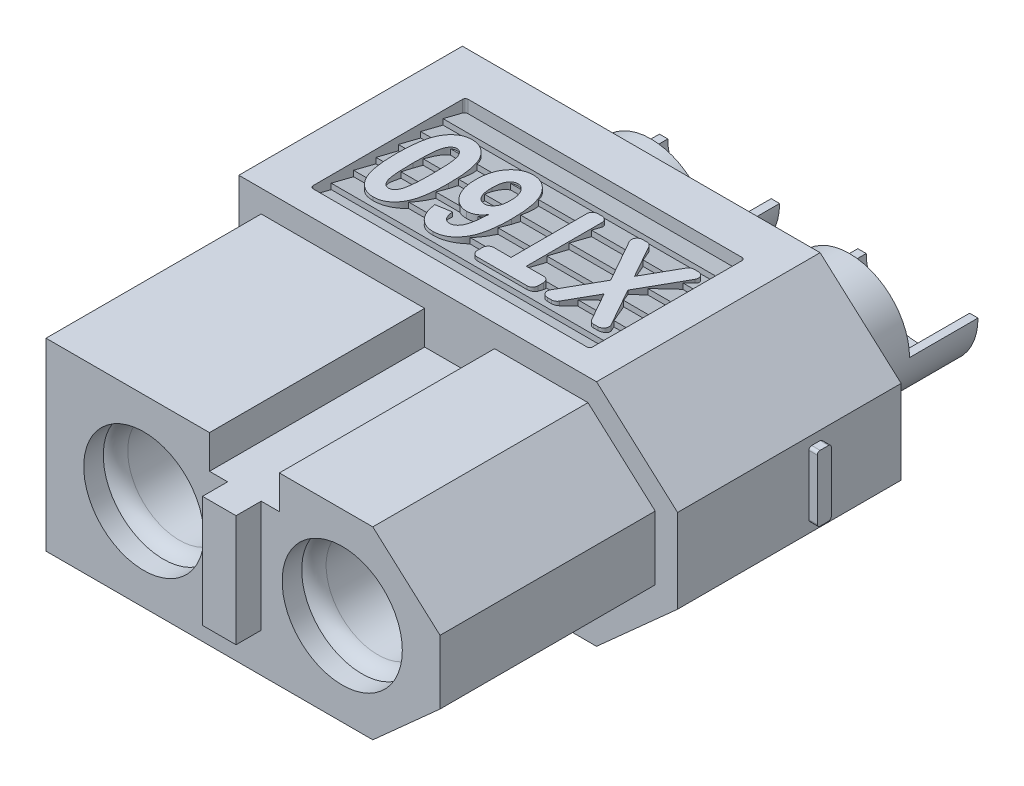
from build123d import *
from OCP.BRepFilletAPI import BRepFilletAPI_MakeChamfer

# Parameters (mm, degrees)
RESSALTO_EXTRUS_O1_DEPTH = 16.2
CORTE_EXTRUS_O1_DEPTH    = 9.4
ESBO_O3_W                = 1.6
ESBO_O3_H                = 0.91
RESSALTO_EXTRUS_O2_DEPTH = 8
ESBO_O4_W                = 1.6
ESBO_O4_H                = 4.7
CORTE_EXTRUS_O2_DEPTH    = 1.5
ESBO_O5_R                = 3
CORTE_EXTRUS_O3_DEPTH    = 2
ESBO_O6_R                = 2.15
CORTE_EXTRUS_O4_DEPTH    = 23.701762046
RESSALTO_EXTRUS_O3_DEPTH = 0.3
RESSALTO_EXTRUS_O4_DEPTH = 0.3
CORTE_EXTRUS_O5_DEPTH    = 0.75
RESSALTO_EXTRUS_O7_REACH = 25.143
RESSALTO_EXTRUS_O8_DEPTH = 0.3
RESSALTO_EXTRUS_O9_DEPTH = 0.3
CUT_EXTRUDE1_DEPTH       = 10
BOSS_EXTRUDE1_DEPTH      = 1.2
BOSS_EXTRUDE2_START      = 2
SKETCH4_R                = 3
BOSS_EXTRUDE2_DEPTH      = 2
BOSS_EXTRUDE3_DEPTH      = 7.7
SKETCH6_R                = 2.15
CUT_EXTRUDE2_DEPTH       = 0.7
SKETCH7_R                = 1.85
CUT_EXTRUDE3_DEPTH       = 10.65
SKETCH8_R                = 2.15
SKETCH8_R_2              = 1.85
BOSS_EXTRUDE4_DEPTH      = 19.9
CHAMFER1_SIZE            = 1
CHAMFER1_SIZE2           = 1.732050808
SKETCH9_W                = 1.2
SKETCH9_H                = 4
BOSS_EXTRUDE5_DEPTH      = 0.9
SKETCH10_W               = 2.5
SKETCH10_H               = 1.2
CUT_EXTRUDE4_DEPTH       = 7.7
FILLET2_R                = 0.7
SKETCH11_W               = 2.45
SKETCH11_H               = 6.904904847
CUT_EXTRUDE5_DEPTH       = 16.9
CUT_EXTRUDE7_START       = -1
SKETCH12_R               = 3
SKETCH12_R_2             = 2.15
CUT_EXTRUDE7_DEPTH       = 1
CHAMFER3_SIZE2           = 1.7
CHAMFER3_SIZE            = 0.618749398


with BuildPart() as part:
    # Esboço1 → Ressalto-extrusão1 (new body)
    with BuildSketch(Plane.XY):
        Polygon((0, 0), (12.8, 0), (15.7, 2.6), (15.7, 5.6), (12.8, 8.2), (0, 8.2), align=None)
    extrude(amount=RESSALTO_EXTRUS_O1_DEPTH)

    # Esboço2 → Corte-extrusão1 (cut)
    with BuildSketch(Plane.XY.offset(16.2)):
        Polygon((0.75, 7.45), (0.75, 0.75), (12.513018725, 0.75), (14.95, 2.934879763), (14.95, 5.265120237), (12.513018725, 7.45), align=None)
    extrude(amount=-CORTE_EXTRUS_O1_DEPTH, mode=Mode.SUBTRACT)

    # Esboço3 → Ressalto-extrusão2 (add)
    with BuildSketch(Plane.XY.offset(6.8)):
        with Locations((7.9, 1.205)):
            Rectangle(ESBO_O3_W, ESBO_O3_H)
    extrude(amount=RESSALTO_EXTRUS_O2_DEPTH)

    # Esboço4 → Corte-extrusão2 (cut)
    with BuildSketch(Plane.XY.offset(6.8)):
        with Locations((7.9, 4.1)):
            Rectangle(ESBO_O4_W, ESBO_O4_H)
    extrude(amount=-CORTE_EXTRUS_O2_DEPTH, mode=Mode.SUBTRACT)

    # Esboço5 → Corte-extrusão3 (cut)
    with BuildSketch(Plane(origin=(0, 0, 0), x_dir=(-1, 0, 0), z_dir=(0, 0, -1))):
        with Locations((-11.35, 4.1)):
            Circle(ESBO_O5_R)
        with Locations((-4.25, 4.1)):
            Circle(ESBO_O5_R)
    extrude(amount=-CORTE_EXTRUS_O3_DEPTH, mode=Mode.SUBTRACT)

    # Esboço6 → Corte-extrusão4 (cut, through all)
    with BuildSketch(Plane(origin=(0, 0, 2), x_dir=(-1, 0, 0), z_dir=(0, 0, -1))):
        with Locations((-11.35, 4.1)):
            Circle(ESBO_O6_R)
        with Locations((-4.25, 4.1)):
            Circle(ESBO_O6_R)
    extrude(amount=-CORTE_EXTRUS_O4_DEPTH, mode=Mode.SUBTRACT)

    # Esboço7 → Ressalto-extrusão3 (add)
    with BuildSketch(Plane.ZY):
        with BuildLine():
            Line((2.8, 4.35), (2.05, 4.35))
            ThreePointArc((2.05, 4.35), (1.979289322, 4.320710678), (1.95, 4.25))
            Line((1.95, 4.25), (1.95, 3.95))
            ThreePointArc((1.95, 3.95), (1.979289322, 3.879289322), (2.05, 3.85))
            Line((2.05, 3.85), (2.8, 3.85))
            ThreePointArc((2.8, 3.85), (2.870710678, 3.820710678), (2.9, 3.75))
            Line((2.9, 3.75), (2.9, 3))
            ThreePointArc((2.9, 3), (2.929289322, 2.929289322), (3, 2.9))
            Line((3, 2.9), (3.3, 2.9))
            ThreePointArc((3.3, 2.9), (3.370710678, 2.929289322), (3.4, 3))
            Line((3.4, 3), (3.4, 3.75))
            ThreePointArc((3.4, 3.75), (3.429289322, 3.820710678), (3.5, 3.85))
            Line((3.5, 3.85), (4.25, 3.85))
            ThreePointArc((4.25, 3.85), (4.320710678, 3.879289322), (4.35, 3.95))
            Line((4.35, 3.95), (4.35, 4.25))
            ThreePointArc((4.35, 4.25), (4.320710678, 4.320710678), (4.25, 4.35))
            Line((4.25, 4.35), (3.5, 4.35))
            ThreePointArc((3.5, 4.35), (3.429289322, 4.379289322), (3.4, 4.45))
            Line((3.4, 4.45), (3.4, 5.2))
            ThreePointArc((3.4, 5.2), (3.370710678, 5.270710678), (3.3, 5.3))
            Line((3.3, 5.3), (3, 5.3))
            ThreePointArc((3, 5.3), (2.929289322, 5.270710678), (2.9, 5.2))
            Line((2.9, 5.2), (2.9, 4.45))
            ThreePointArc((2.9, 4.45), (2.870710678, 4.379289322), (2.8, 4.35))
        make_face()
    extrude(amount=RESSALTO_EXTRUS_O3_DEPTH)

    # Esboço8 → Ressalto-extrusão4 (add)
    with BuildSketch(Plane(origin=(15.7, 0, 0), x_dir=(0, 0, -1), z_dir=(1, 0, 0))):
        with BuildLine():
            Line((-3.2, 2.925), (-2.9, 2.925))
            ThreePointArc((-2.9, 2.925), (-2.829289322, 2.954289322), (-2.8, 3.025))
            Line((-2.8, 3.025), (-2.8, 5.175))
            ThreePointArc((-2.8, 5.175), (-2.829289322, 5.245710678), (-2.9, 5.275))
            Line((-2.9, 5.275), (-3.2, 5.275))
            ThreePointArc((-3.2, 5.275), (-3.270710678, 5.245710678), (-3.3, 5.175))
            Line((-3.3, 5.175), (-3.3, 3.025))
            ThreePointArc((-3.3, 3.025), (-3.270710678, 2.954289322), (-3.2, 2.925))
        make_face()
    extrude(amount=RESSALTO_EXTRUS_O4_DEPTH)

    # Esboço9 → Corte-extrusão5 (cut)
    with BuildSketch(Plane.XZ):
        with BuildLine():
            Line((1.75, 7.093123445), (11.55, 7.093123445))
            ThreePointArc((11.55, 7.093123445), (11.620710678, 7.063834123), (11.65, 6.993123445))
            Line((11.65, 6.993123445), (11.65, 1.643123445))
            ThreePointArc((11.65, 1.643123445), (11.620710678, 1.572412766), (11.55, 1.543123445))
            Line((11.55, 1.543123445), (1.75, 1.543123445))
            ThreePointArc((1.75, 1.543123445), (1.679289322, 1.572412766), (1.65, 1.643123445))
            Line((1.65, 1.643123445), (1.65, 6.993123445))
            ThreePointArc((1.65, 6.993123445), (1.679289322, 7.063834123), (1.75, 7.093123445))
        make_face()
    corte_extrus_o5 = extrude(amount=-CORTE_EXTRUS_O5_DEPTH, mode=Mode.SUBTRACT)

    # Ressalto-extrusão7: up to this face of the body (flat: up to its plane)
    ressalto_extrus_o7_end = Plane(part.part.faces().sort_by_distance((11.65, 0.375, 4.318123445))[0])
    # Esboço10 → Ressalto-extrusão7 (add, up to the picked face)
    with BuildSketch(Plane(origin=(1.65, 0, 0), x_dir=(0, 0, -1), z_dir=(1, 0, 0)), mode=Mode.PRIVATE) as ressalto_extrus_o7_sk1:
        Polygon((-3.143123445, 0.45), (-3.143123445, 0.25), (-2.343123445, 0.45), (-2.343123445, 0.25), (-1.543123445, 0.45), (-1.543123445, 0.75), (-7.143123445, 0.75), (-7.143123445, 0.45), (-7.143123445, 0.25), (-6.343123445, 0.45), (-6.343123445, 0.25), (-5.543123445, 0.45), (-5.543123445, 0.25), (-4.743123445, 0.45), (-4.743123445, 0.25), (-3.943123445, 0.45), (-3.943123445, 0.25), align=None)
    ressalto_extrus_o7_tool1 = split(extrude(ressalto_extrus_o7_sk1.sketch, amount=RESSALTO_EXTRUS_O7_REACH, mode=Mode.PRIVATE), bisect_by=ressalto_extrus_o7_end, keep=Keep.BOTH, mode=Mode.PRIVATE)
    ressalto_extrus_o7 = ressalto_extrus_o7_tool1.solids().sort_by(Axis((1.65, 0.545833, 4.376457), (1, 0, 0)))[0]
    add(ressalto_extrus_o7)

    # Espelhar1: Corte-extrusão5, Ressalto-extrusão7 across plane
    add(corte_extrus_o5.mirror(Plane.ZX.offset(4.1)), mode=Mode.SUBTRACT)
    add(ressalto_extrus_o7.mirror(Plane.ZX.offset(4.1)))

    # Esboço11 → Ressalto-extrusão8 (add)
    with BuildSketch(Plane(origin=(0, 0.5, 0), x_dir=(-1, 0, 0), z_dir=(0, -1, 0))):
        with BuildLine():
            add(Edge.make_bspline(
                [(-5.023961169, -6.00435038), (-5.023731287, -5.995665006), (-5.023167139, -5.974350412), (-5.020606597, -5.937326865), (-5.015634685, -5.891913541), (-5.008374694, -5.840781928), (-4.996852924, -5.786628833), (-4.98507998, -5.730621834), (-4.970342979, -5.676032154), (-4.952923205, -5.625615372), (-4.932961076, -5.58080345), (-4.908069139, -5.546064886), (-4.881021, -5.518802059), (-4.858555504, -5.515226002), (-4.848332577, -5.513598717)],
                knots=[0, 0, 0, 0, 0.571173607, 1.401705031, 2.438868434, 3.574367159, 4.795071872, 6.077422199, 7.33722776, 8.507872236, 9.587019565, 10.5375099, 11.334493681, 12, 12, 12, 12], degree=3))
            Line((-4.848332577, -5.513598717), (-4.020609309, -5.513598717))
            Line((-4.020609309, -5.513598717), (-3.49036222, -2.555643484))
            add(Edge.make_bspline(
                [(-3.49036222, -2.555643484), (-3.487094486, -2.546511208), (-3.480493928, -2.528064751), (-3.462940698, -2.502333792), (-3.435671591, -2.480838398), (-3.397551986, -2.465314687), (-3.349369795, -2.453459182), (-3.289027368, -2.44320829), (-3.214317598, -2.436547775), (-3.159289179, -2.436398815), (-3.129021098, -2.436316881)],
                knots=[0, 0, 0, 0, 0.572152175, 1.155701031, 1.815395622, 2.59412663, 3.570478222, 4.74694284, 6.210673715, 8, 8, 8, 8], degree=3))
            add(Edge.make_bspline(
                [(-3.129021098, -2.436316881), (-3.099590319, -2.436400624), (-3.045954651, -2.43655324), (-2.973504555, -2.44319605), (-2.916339343, -2.453001646), (-2.873392308, -2.464895138), (-2.841745516, -2.480373872), (-2.823600732, -2.503205048), (-2.815413627, -2.529106558), (-2.817188659, -2.546643114), (-2.818099667, -2.555643484)],
                knots=[0, 0, 0, 0, 1.887972692, 3.440706659, 4.664361098, 5.602810567, 6.303007865, 6.878566498, 7.424441367, 8, 8, 8, 8], degree=3))
            Line((-2.818099667, -2.555643484), (-3.348346756, -5.513598717))
            Line((-3.348346756, -5.513598717), (-2.527346113, -5.513598717))
            add(Edge.make_bspline(
                [(-2.527346113, -5.513598717), (-2.5158995, -5.51461475), (-2.493831667, -5.516573553), (-2.472715893, -5.546733002), (-2.463160736, -5.584517711), (-2.462285798, -5.613492933), (-2.461800514, -5.629564007)],
                knots=[0, 0, 0, 0, 0.876044977, 1.688920123, 2.718162199, 4, 4, 4, 4], degree=3))
            add(Edge.make_bspline(
                [(-2.461800514, -5.629564007), (-2.461977539, -5.638813278), (-2.462407487, -5.661277307), (-2.466216965, -5.699071845), (-2.470998184, -5.745356077), (-2.478414587, -5.796958197), (-2.488582941, -5.852446205), (-2.500798033, -5.908853075), (-2.514928426, -5.964134452), (-2.534662336, -6.013696946), (-2.55458049, -6.057861337), (-2.578178377, -6.092213603), (-2.605428151, -6.117627625), (-2.627240684, -6.121178211), (-2.637429106, -6.122836655)],
                knots=[0, 0, 0, 0, 0.605043227, 1.469489812, 2.48341245, 3.649686645, 4.879047589, 6.17309233, 7.426799419, 8.604393452, 9.661770922, 10.582105409, 11.337715268, 12, 12, 12, 12], degree=3))
            Line((-2.637429106, -6.122836655), (-4.960096227, -6.122836655))
            add(Edge.make_bspline(
                [(-4.960096227, -6.122836655), (-4.969934281, -6.121426251), (-4.99037917, -6.118495228), (-5.011571026, -6.089692698), (-5.021864767, -6.050856537), (-5.023211361, -6.020983972), (-5.023961169, -6.00435038)],
                knots=[0, 0, 0, 0, 0.771159906, 1.602580858, 2.665073155, 4, 4, 4, 4], degree=3))
        make_face()
        with BuildLine():
            add(Edge.make_bspline(
                [(-8.005445591, -5.732084047), (-8.005233805, -5.721157588), (-8.004755518, -5.69648183), (-8.002257862, -5.656087157), (-7.997216524, -5.609824927), (-7.989672588, -5.559640101), (-7.979672262, -5.507819052), (-7.968127736, -5.455855322), (-7.954624636, -5.406442246), (-7.937593996, -5.361995207), (-7.919841845, -5.322908562), (-7.899498565, -5.292757131), (-7.878287508, -5.269109619), (-7.86042282, -5.265583769), (-7.852505861, -5.264021244)],
                knots=[0, 0, 0, 0, 0.766224037, 1.73040148, 2.836554055, 4.028156414, 5.287742343, 6.536100283, 7.760906599, 8.873491865, 9.874955351, 10.751978432, 11.446923712, 12, 12, 12, 12], degree=3))
            add(Edge.make_bspline(
                [(-7.852505861, -5.264021244), (-7.845452061, -5.264904506), (-7.829851748, -5.266857944), (-7.804797296, -5.276024895), (-7.776406148, -5.29162043), (-7.730609729, -5.322094595), (-7.661287561, -5.366554766), (-7.562598175, -5.424293206), (-7.440427841, -5.481447336), (-7.322385437, -5.522805842), (-7.215484092, -5.550613186), (-7.125251104, -5.565599411), (-7.027726856, -5.57352652), (-6.960370911, -5.575015091), (-6.925623866, -5.575783003)],
                knots=[0, 0, 0, 0, 0.256781181, 0.567901939, 0.958081965, 1.427920935, 2.558951999, 3.940235169, 5.564546954, 7.434602361, 8.460374185, 9.560843022, 10.741707222, 12, 12, 12, 12], degree=3))
            add(Edge.make_bspline(
                [(-6.925623866, -5.575783003), (-6.890276179, -5.575112001), (-6.820714939, -5.573791525), (-6.71881609, -5.559310648), (-6.620879787, -5.539244265), (-6.528038512, -5.508289798), (-6.439439434, -5.470183053), (-6.354808917, -5.425881372), (-6.274209796, -5.374938124), (-6.197898312, -5.317782161), (-6.125337935, -5.254656842), (-6.057780279, -5.185519577), (-5.993086757, -5.112490516), (-5.915245473, -5.00655333), (-5.827853488, -4.865004138), (-5.741758712, -4.683337999), (-5.673142777, -4.492613249), (-5.626520902, -4.295160578), (-5.595410147, -4.096109002), (-5.592019032, -3.96274579), (-5.59034237, -3.896807277)],
                knots=[0, 0, 0, 0, 0.80118641, 1.5766667, 2.33060899, 3.065984097, 3.79180022, 4.516503127, 5.230402579, 5.952175127, 6.677184339, 7.409506429, 8.143480375, 8.888129179, 10.388673858, 11.909102309, 13.440443778, 14.976838324, 16.505264068, 18, 18, 18, 18], degree=3))
            add(Edge.make_bspline(
                [(-5.59034237, -3.896807277), (-5.590871805, -3.861481942), (-5.591899808, -3.792890748), (-5.603110001, -3.693712719), (-5.620667577, -3.601229886), (-5.644851035, -3.51534807), (-5.675878531, -3.435840868), (-5.713888363, -3.363292733), (-5.757702979, -3.297278928), (-5.807513278, -3.237950776), (-5.863357452, -3.185891772), (-5.924157557, -3.139448548), (-5.992135639, -3.102310572), (-6.064487022, -3.070033176), (-6.14190109, -3.044779053), (-6.224178948, -3.027460146), (-6.310743564, -3.016057319), (-6.370129331, -3.015001296), (-6.400418746, -3.014462676)],
                knots=[0, 0, 0, 0, 1.245481004, 2.418350133, 3.515051619, 4.562728981, 5.560783658, 6.519734471, 7.445909044, 8.350382342, 9.245035617, 10.134216955, 11.041061373, 11.969972066, 12.926017502, 13.906558924, 14.932250809, 16, 16, 16, 16], degree=3))
            add(Edge.make_bspline(
                [(-6.400418746, -3.014462676), (-6.441984642, -3.015611215), (-6.525415258, -3.017916548), (-6.647858981, -3.041043496), (-6.766205581, -3.074435661), (-6.838672757, -3.110262009), (-6.874363846, -3.127906982)],
                knots=[0, 0, 0, 0, 1.012553476, 2.032386399, 3.030923011, 4, 4, 4, 4], degree=3))
            Line((-6.874363846, -3.127906982), (-7.027303577, -3.975798127))
            Line((-7.027303577, -3.975798127), (-6.405460715, -3.975798127))
            add(Edge.make_bspline(
                [(-6.405460715, -3.975798127), (-6.396032338, -3.977054064), (-6.376498001, -3.979656199), (-6.354225524, -4.004786531), (-6.340822506, -4.042285405), (-6.340248828, -4.071973018), (-6.339915116, -4.089242433)],
                knots=[0, 0, 0, 0, 0.76021162, 1.575056727, 2.589399796, 4, 4, 4, 4], degree=3))
            add(Edge.make_bspline(
                [(-6.339915116, -4.089242433), (-6.340007123, -4.100178481), (-6.34021529, -4.124921501), (-6.345257389, -4.164911883), (-6.350408738, -4.210435976), (-6.359386856, -4.258457362), (-6.368207285, -4.308513896), (-6.379561212, -4.358263352), (-6.393351556, -4.406000103), (-6.410607636, -4.448661231), (-6.431034, -4.484869643), (-6.451535593, -4.514643738), (-6.476695242, -4.535852891), (-6.496191515, -4.539001749), (-6.50545977, -4.540498671)],
                knots=[0, 0, 0, 0, 0.777619142, 1.759378421, 2.864503789, 4.037640318, 5.233916541, 6.481404614, 7.667005543, 8.766363746, 9.747920663, 10.616982492, 11.342532841, 12, 12, 12, 12], degree=3))
            Line((-6.50545977, -4.540498671), (-7.618054295, -4.540498671))
            add(Edge.make_bspline(
                [(-7.618054295, -4.540498671), (-7.631028748, -4.539695256), (-7.655886414, -4.538155997), (-7.690371762, -4.526433837), (-7.718598065, -4.50614808), (-7.74018276, -4.478209964), (-7.754374786, -4.44306982), (-7.760248857, -4.401532584), (-7.761457637, -4.353981025), (-7.756174688, -4.320568781), (-7.753347134, -4.302685793)],
                knots=[0, 0, 0, 0, 0.968467303, 1.855479917, 2.680305945, 3.530243379, 4.459230605, 5.47774572, 6.650032557, 8, 8, 8, 8], degree=3))
            Line((-7.753347134, -4.302685793), (-7.488643754, -2.832951787))
            add(Edge.make_bspline(
                [(-7.488643754, -2.832951787), (-7.484932567, -2.816378345), (-7.478008418, -2.785456437), (-7.46492174, -2.741793185), (-7.446178544, -2.7041663), (-7.430134023, -2.682328748), (-7.422257827, -2.671608774)],
                knots=[0, 0, 0, 0, 1.156316651, 2.157398464, 3.095473648, 4, 4, 4, 4], degree=3))
            add(Edge.make_bspline(
                [(-7.422257827, -2.671608774), (-7.416231591, -2.665574456), (-7.402120311, -2.651444251), (-7.37426183, -2.631630505), (-7.336320112, -2.612116828), (-7.271721396, -2.580005779), (-7.173655195, -2.540224112), (-7.038673137, -2.495401693), (-6.884344834, -2.453408859), (-6.714006485, -2.419933315), (-6.533346086, -2.394808927), (-6.409750166, -2.392235662), (-6.34747807, -2.390939158)],
                knots=[0, 0, 0, 0, 0.226925493, 0.53137799, 0.905335483, 1.362486358, 2.452980185, 3.720011825, 5.149871189, 6.709721602, 8.342238718, 10, 10, 10, 10], degree=3))
            add(Edge.make_bspline(
                [(-6.34747807, -2.390939158), (-6.290017279, -2.392085578), (-6.17847988, -2.394310898), (-6.016534188, -2.41097196), (-5.865393213, -2.439681829), (-5.724343707, -2.47847325), (-5.594644173, -2.53031849), (-5.474482576, -2.59117225), (-5.366924212, -2.665978248), (-5.269134234, -2.750285511), (-5.183278961, -2.846044213), (-5.107514929, -2.951618377), (-5.045184949, -3.068619941), (-4.991498741, -3.194272892), (-4.950571377, -3.330444745), (-4.92155039, -3.476194463), (-4.903510692, -3.631932588), (-4.901479969, -3.739054811), (-4.900432925, -3.794287238)],
                knots=[0, 0, 0, 0, 1.198820216, 2.327035275, 3.391905235, 4.405853918, 5.373943326, 6.301912563, 7.209749437, 8.100436241, 8.990125377, 9.886946289, 10.804904538, 11.750377292, 12.733955993, 13.765538726, 14.847907423, 16, 16, 16, 16], degree=3))
            add(Edge.make_bspline(
                [(-4.900432925, -3.794287238), (-4.900905574, -3.845294829), (-4.901844387, -3.946610285), (-4.914742729, -4.097966778), (-4.932583422, -4.247805266), (-4.958701667, -4.395928796), (-4.99253789, -4.541087834), (-5.032356058, -4.683657708), (-5.081529457, -4.821948844), (-5.13678848, -4.956828646), (-5.199584663, -5.086811605), (-5.270198263, -5.211779027), (-5.345934724, -5.33288119), (-5.430056432, -5.447884454), (-5.521068083, -5.55643969), (-5.618182845, -5.658754515), (-5.724187844, -5.75176642), (-5.835355528, -5.838862544), (-5.954599059, -5.916135709), (-6.079758992, -5.985133465), (-6.211692275, -6.045266744), (-6.350247896, -6.095365279), (-6.495259856, -6.136376965), (-6.647191877, -6.164275874), (-6.805564122, -6.182714335), (-6.913525434, -6.184799742), (-6.968480603, -6.18586127)],
                knots=[0, 0, 0, 0, 1.038419447, 2.062593738, 3.091332759, 4.110730389, 5.12359561, 6.125738619, 7.123390902, 8.110666656, 9.092886964, 10.060808202, 11.032487199, 12.000004954, 12.959688702, 13.915839818, 14.869418181, 15.828983254, 16.789344864, 17.759482257, 18.737170252, 19.738663678, 20.757278993, 21.802195652, 22.881259323, 24, 24, 24, 24], degree=3))
            add(Edge.make_bspline(
                [(-6.968480603, -6.18586127), (-7.0290792, -6.184331494), (-7.147145904, -6.18135097), (-7.317412746, -6.155941012), (-7.473193069, -6.119872726), (-7.612804056, -6.077894875), (-7.732975101, -6.029341039), (-7.819588267, -5.98510127), (-7.876269531, -5.949103523), (-7.909395725, -5.926063462), (-7.935436602, -5.907072311), (-7.960438269, -5.88640523), (-7.981066611, -5.858738461), (-7.997461203, -5.821981054), (-8.004140504, -5.77910018), (-8.004986589, -5.74861974), (-8.005445591, -5.732084047)],
                knots=[0, 0, 0, 0, 2.087911378, 4.067962421, 5.920740836, 7.59756473, 9.087613358, 10.383270069, 10.94314657, 11.401166784, 11.773890065, 12.054576704, 12.51614555, 12.948510593, 13.429565086, 14, 14, 14, 14], degree=3))
        make_face()
        with BuildLine():
            Line((-9.699547225, -3.845547257), (-9.470137629, -2.552282171))
            add(Edge.make_bspline(
                [(-9.470137629, -2.552282171), (-9.466859766, -2.543161727), (-9.460238748, -2.52473917), (-9.442946515, -2.498964908), (-9.414937846, -2.478219246), (-9.376716334, -2.463027083), (-9.328197381, -2.450399387), (-9.267224842, -2.442997509), (-9.192960802, -2.436667812), (-9.138508583, -2.436440768), (-9.108796506, -2.436316881)],
                knots=[0, 0, 0, 0, 0.573468519, 1.15835994, 1.80927796, 2.60501552, 3.583613393, 4.774068884, 6.239757445, 8, 8, 8, 8], degree=3))
            add(Edge.make_bspline(
                [(-9.108796506, -2.436316881), (-9.07908089, -2.4364132), (-9.025460301, -2.436587003), (-8.953170251, -2.442958428), (-8.895984093, -2.450121251), (-8.853113738, -2.462392488), (-8.821882373, -2.47787117), (-8.803149573, -2.499931887), (-8.795230917, -2.525777934), (-8.796978272, -2.543292888), (-8.797875076, -2.552282171)],
                knots=[0, 0, 0, 0, 1.911024314, 3.448363529, 4.669437815, 5.610387303, 6.312449918, 6.875579012, 7.422908085, 8, 8, 8, 8], degree=3))
            Line((-8.797875076, -2.552282171), (-9.027284672, -3.845547257))
            Line((-9.027284672, -3.845547257), (-8.486953645, -5.845528352))
            add(Edge.make_bspline(
                [(-8.486953645, -5.845528352), (-8.478833829, -5.87511468), (-8.464477661, -5.927424524), (-8.452459229, -5.997552522), (-8.451114009, -6.053647581), (-8.470343992, -6.090049885), (-8.495365993, -6.108483462), (-8.519933136, -6.118787125), (-8.549846675, -6.127196016), (-8.58564508, -6.132928512), (-8.62837865, -6.135711651), (-8.678523457, -6.13827363), (-8.736802258, -6.139884763), (-8.778266582, -6.140275181), (-8.80039606, -6.140483547)],
                knots=[0, 0, 0, 0, 1.871476962, 3.308848235, 4.353767051, 5.234513845, 5.686208054, 6.229944972, 6.852727002, 7.581222775, 8.43941278, 9.467243455, 10.648269802, 12, 12, 12, 12], degree=3))
            add(Edge.make_bspline(
                [(-8.80039606, -6.140483547), (-8.832318453, -6.140341829), (-8.888907188, -6.140090606), (-8.964273956, -6.138021895), (-9.021780456, -6.129917263), (-9.066180039, -6.120808034), (-9.098903106, -6.102781231), (-9.120223894, -6.076561798), (-9.13175067, -6.04348518), (-9.138106211, -6.019785287), (-9.141569306, -6.006871365)],
                knots=[0, 0, 0, 0, 1.872853804, 3.32000257, 4.414278968, 5.278892846, 5.96356431, 6.558835249, 7.214718403, 8, 8, 8, 8], degree=3))
            Line((-9.141569306, -6.006871365), (-9.363415948, -5.124526764))
            add(Edge.make_bspline(
                [(-9.363415948, -5.124526764), (-9.375252204, -5.073003414), (-9.398319243, -4.972592338), (-9.4313429, -4.82328113), (-9.459458724, -4.674488444), (-9.474906837, -4.574439649), (-9.482742551, -4.523692108)],
                knots=[0, 0, 0, 0, 1.035280845, 2.017602979, 2.994472888, 4, 4, 4, 4], degree=3))
            Line((-9.482742551, -4.523692108), (-9.487784521, -4.523692108))
            add(Edge.make_bspline(
                [(-9.487784521, -4.523692108), (-9.511639997, -4.574225455), (-9.559347354, -4.675284529), (-9.635013885, -4.824621142), (-9.714451456, -4.972922929), (-9.770445333, -5.070325057), (-9.798705951, -5.119484795)],
                knots=[0, 0, 0, 0, 0.997419509, 1.994688626, 2.987901158, 4, 4, 4, 4], degree=3))
            Line((-9.798705951, -5.119484795), (-10.326432055, -6.015274647))
            add(Edge.make_bspline(
                [(-10.326432055, -6.015274647), (-10.333247008, -6.02658162), (-10.346131701, -6.047959155), (-10.367813932, -6.077469508), (-10.397293269, -6.100071343), (-10.435252647, -6.11659373), (-10.484479232, -6.127846444), (-10.547170712, -6.136190535), (-10.628360793, -6.139453445), (-10.688895234, -6.140111868), (-10.723066962, -6.140483547)],
                knots=[0, 0, 0, 0, 0.717854675, 1.357212346, 1.975202924, 2.710745717, 3.589209825, 4.710534674, 6.143094915, 8, 8, 8, 8], degree=3))
            add(Edge.make_bspline(
                [(-10.723066962, -6.140483547), (-10.746315279, -6.140244969), (-10.789737126, -6.139799365), (-10.850571208, -6.138566379), (-10.902659649, -6.134868561), (-10.946544735, -6.131420338), (-10.982700322, -6.124853597), (-11.011731032, -6.115530144), (-11.035346625, -6.104645101), (-11.05126765, -6.088522037), (-11.061638069, -6.069687635), (-11.063660752, -6.047269133), (-11.058519319, -6.022504265), (-11.043126489, -5.98211466), (-11.009623355, -5.922933123), (-10.97952139, -5.87342411), (-10.962560496, -5.845528352)],
                knots=[0, 0, 0, 0, 1.604706746, 2.9971774, 4.198278929, 5.208200935, 6.034760513, 6.725606941, 7.313579332, 7.805702227, 8.264006837, 8.76998451, 9.319854892, 9.998695175, 11.74547258, 14, 14, 14, 14], degree=3))
            Line((-10.962560496, -5.845528352), (-9.699547225, -3.845547257))
        make_face()
    extrude(amount=RESSALTO_EXTRUS_O8_DEPTH)

    # Esboço12 → Ressalto-extrusão9 (add)
    # profile 1 of 4: a face of its own
    with BuildSketch(Plane(origin=(0, 7.7, 0), x_dir=(1, 0, 0), z_dir=(0, 1, 0))):
        with BuildLine():
            Line((11.185044584, -2.866454717), (10.320104725, -4.398379126))
            Line((10.320104725, -4.398379126), (11.094198639, -5.769814539))
            ThreePointArc((11.094198639, -5.769814539), (11.092744365, -5.968965447), (10.920028151, -6.068123445))
            Line((10.920028151, -6.068123445), (10.7649422, -6.068123445))
            ThreePointArc((10.7649422, -6.068123445), (10.664138477, -6.040862003), (10.590815302, -5.966509539))
            Line((10.590815302, -5.966509539), (10.012576316, -4.943123445))
            Line((10.012576316, -4.943123445), (9.435030455, -5.966426179))
            ThreePointArc((9.435030455, -5.966426179), (9.361701545, -6.040837872), (9.260856483, -6.068123445))
            Line((9.260856483, -6.068123445), (9.105124481, -6.068123445))
            ThreePointArc((9.105124481, -6.068123445), (8.932408267, -5.968965447), (8.930953993, -5.769814539))
            Line((8.930953993, -5.769814539), (9.705047907, -4.398379126))
            Line((9.705047907, -4.398379126), (8.840108048, -2.866454717))
            ThreePointArc((8.840108048, -2.866454717), (8.841543221, -2.667292533), (9.01426591, -2.568123445))
            Line((9.01426591, -2.568123445), (9.169940798, -2.568123445))
            ThreePointArc((9.169940798, -2.568123445), (9.270790107, -2.595411497), (9.344119604, -2.669829276))
            Line((9.344119604, -2.669829276), (10.012576316, -3.854345035))
            Line((10.012576316, -3.854345035), (10.681728288, -2.669756355))
            ThreePointArc((10.681728288, -2.669756355), (10.755052773, -2.595390388), (10.855865922, -2.568123445))
            Line((10.855865922, -2.568123445), (11.010886722, -2.568123445))
            ThreePointArc((11.010886722, -2.568123445), (11.183609411, -2.667292533), (11.185044584, -2.866454717))
        make_face()
    # profile 2 of 4: a face of its own
    with BuildSketch(Plane(origin=(0, 7.7, 0), x_dir=(1, 0, 0), z_dir=(0, 1, 0))):
        with BuildLine():
            Line((7.762576316, -2.768123445), (7.762576316, -5.477214354))
            Line((7.762576316, -5.477214354), (8.380758134, -5.477214354))
            ThreePointArc((8.380758134, -5.477214354), (8.522179491, -5.535792997), (8.580758134, -5.677214354))
            Line((8.580758134, -5.677214354), (8.580758134, -5.868123445))
            ThreePointArc((8.580758134, -5.868123445), (8.522179491, -6.009544801), (8.380758134, -6.068123445))
            Line((8.380758134, -6.068123445), (6.598939953, -6.068123445))
            ThreePointArc((6.598939953, -6.068123445), (6.457518596, -6.009544801), (6.398939953, -5.868123445))
            Line((6.398939953, -5.868123445), (6.398939953, -5.677214354))
            ThreePointArc((6.398939953, -5.677214354), (6.457518596, -5.535792997), (6.598939953, -5.477214354))
            Line((6.598939953, -5.477214354), (7.217121771, -5.477214354))
            Line((7.217121771, -5.477214354), (7.217121771, -2.768123445))
            ThreePointArc((7.217121771, -2.768123445), (7.275700414, -2.626702088), (7.417121771, -2.568123445))
            Line((7.417121771, -2.568123445), (7.562576316, -2.568123445))
            ThreePointArc((7.562576316, -2.568123445), (7.703997672, -2.626702088), (7.762576316, -2.768123445))
        make_face()
    # profile 3 of 4: a face of its own
    with BuildSketch(Plane(origin=(0, 7.7, 0), x_dir=(1, 0, 0), z_dir=(0, 1, 0))):
        with BuildLine():
            Line((4.217121771, -5.204487081), (4.762576316, -5.11357799))
            add(Edge.make_bspline(
                [(4.762576316, -5.11357799), (4.76820949, -5.173924633), (4.781337444, -5.259439061), (4.819168165, -5.361191101), (4.853361229, -5.419789109), (4.894424887, -5.466597978), (4.961777465, -5.510957772), (5.022038471, -5.523265851), (5.062292225, -5.522668899)],
                knots=[0, 0, 0, 0, 0.323351038, 0.457031878, 0.575725889, 0.682827962, 0.785621923, 1, 1, 1, 1], degree=3))
            add(Edge.make_bspline(
                [(5.062292225, -5.522668899), (5.090005536, -5.523271256), (5.131240753, -5.516505903), (5.183240033, -5.496464747), (5.220091612, -5.475090137), (5.254809063, -5.44738128), (5.287295538, -5.413652015), (5.318784831, -5.374418203), (5.348496948, -5.327992624), (5.375862324, -5.27190132), (5.400526587, -5.204375405), (5.42080653, -5.124170881), (5.441377932, -5.032489264), (5.456741962, -4.927718403), (5.47688134, -4.763925871), (5.485298827, -4.634283794), (5.489849043, -4.543975717)],
                knots=[0, 0, 0, 0, 0.07110629, 0.106432223, 0.14303469, 0.180361233, 0.220458154, 0.263402163, 0.309743564, 0.362096385, 0.423824058, 0.494518004, 0.575001043, 0.665717727, 0.767054977, 1, 1, 1, 1], degree=3))
            add(Edge.make_bspline(
                [(5.489849043, -4.543975717), (5.458325439, -4.59029492), (5.407025482, -4.654615722), (5.327609617, -4.725483765), (5.267100836, -4.768088661), (5.202789438, -4.800226136), (5.112590312, -4.832606749), (5.040111771, -4.83988466), (4.991979725, -4.840850717)],
                knots=[0, 0, 0, 0, 0.277998008, 0.405177954, 0.526602292, 0.643637452, 0.760548992, 1, 1, 1, 1], degree=3))
            add(Edge.make_bspline(
                [(4.991979725, -4.840850717), (4.938397795, -4.840049228), (4.857644594, -4.832427325), (4.755876709, -4.798007625), (4.682335645, -4.763632003), (4.610596897, -4.720231075), (4.542640345, -4.665558625), (4.476889163, -4.601961344), (4.414752476, -4.529006286), (4.357734038, -4.448067208), (4.307371702, -4.360004902), (4.266071161, -4.265189584), (4.230469873, -4.164568314), (4.205010426, -4.057053869), (4.1786726, -3.902079336), (4.170937798, -3.781658743), (4.171667225, -3.69951549)],
                knots=[0, 0, 0, 0, 0.103373273, 0.154207333, 0.205955138, 0.259297376, 0.315055498, 0.373346508, 0.435038939, 0.499094576, 0.56354236, 0.62980043, 0.697776404, 0.768573701, 0.842016383, 1, 1, 1, 1], degree=3))
            add(Edge.make_bspline(
                [(4.171667225, -3.69951549), (4.17185896, -3.612421658), (4.179060828, -3.485146498), (4.205900348, -3.321369203), (4.234396433, -3.20963002), (4.2696034, -3.104366118), (4.314707671, -3.007473367), (4.366288245, -2.916922605), (4.426957594, -2.835664661), (4.492885026, -2.762488286), (4.56321129, -2.698010574), (4.638016826, -2.644053991), (4.716117978, -2.599205297), (4.798442704, -2.564863658), (4.914867128, -2.532610579), (5.005897079, -2.522349793), (5.067263816, -2.522668899)],
                knots=[0, 0, 0, 0, 0.157846943, 0.230497149, 0.300424491, 0.366636184, 0.431332033, 0.493808926, 0.555163499, 0.614703094, 0.672106668, 0.727718583, 0.781520235, 0.834985538, 0.88891022, 1, 1, 1, 1], degree=3))
            add(Edge.make_bspline(
                [(5.067263816, -2.522668899), (5.134776318, -2.522388948), (5.235013241, -2.535219464), (5.362092148, -2.577511404), (5.451550186, -2.622540527), (5.536655096, -2.680446511), (5.616741921, -2.751072456), (5.692332527, -2.834441462), (5.763971124, -2.930110778), (5.82918472, -3.04081959), (5.883929661, -3.168816952), (5.931571611, -3.312472802), (5.969029009, -3.473320865), (5.999665981, -3.650168244), (6.028262771, -3.919162037), (6.035311504, -4.129776969), (6.035303589, -4.275509808)],
                knots=[0, 0, 0, 0, 0.090693495, 0.134685131, 0.179530034, 0.224912922, 0.272737739, 0.322760271, 0.375986421, 0.433203955, 0.495069598, 0.562818628, 0.636478469, 0.716917714, 0.804030531, 1, 1, 1, 1], degree=3))
            add(Edge.make_bspline(
                [(6.035303589, -4.275509808), (6.035321208, -4.423581802), (6.028586042, -4.637939475), (5.997249035, -4.911199563), (5.966641992, -5.091655496), (5.926254815, -5.255456188), (5.877882298, -5.403133674), (5.820063121, -5.534267496), (5.751835344, -5.647887006), (5.677444095, -5.746891367), (5.597624044, -5.832519938), (5.513228762, -5.905957941), (5.422406745, -5.96445997), (5.327623343, -6.011484887), (5.191786058, -6.055622146), (5.084345761, -6.068641489), (5.011866089, -6.068123445)],
                knots=[0, 0, 0, 0, 0.192657569, 0.278521348, 0.357596923, 0.430563241, 0.497752602, 0.559502274, 0.616536619, 0.669746994, 0.720292489, 0.768554988, 0.814846956, 0.860430936, 0.905808517, 1, 1, 1, 1], degree=3))
            add(Edge.make_bspline(
                [(5.011866089, -6.068123445), (4.961903446, -6.06789345), (4.888028114, -6.061626473), (4.793001037, -6.039603881), (4.725795095, -6.016102048), (4.661944049, -5.985106158), (4.600204149, -5.948907027), (4.541772821, -5.905419857), (4.487247773, -5.854566598), (4.43554269, -5.798076733), (4.390262811, -5.733146732), (4.348758109, -5.662053174), (4.313065822, -5.583489418), (4.280538021, -5.498839828), (4.24537643, -5.372392174), (4.226035204, -5.273167916), (4.217121771, -5.204487081)],
                knots=[0, 0, 0, 0, 0.115543302, 0.170649433, 0.225187049, 0.279790566, 0.334525644, 0.390473716, 0.447810616, 0.506730268, 0.567186295, 0.630471054, 0.696846024, 0.766492743, 0.839958973, 1, 1, 1, 1], degree=3))
        make_face()
        with BuildLine():
            add(Edge.make_bspline(
                [(5.444394498, -3.721532535), (5.443413243, -3.671816504), (5.441774499, -3.598919405), (5.428964767, -3.50575196), (5.416513606, -3.442460626), (5.39901126, -3.384318695), (5.379738685, -3.329960639), (5.355461716, -3.280752232), (5.327421984, -3.236743151), (5.298038654, -3.197058094), (5.266817632, -3.162801594), (5.234319039, -3.134257306), (5.201874492, -3.109517602), (5.167408759, -3.090781113), (5.119948206, -3.073930539), (5.082776396, -3.068257967), (5.058030862, -3.068123445)],
                knots=[0, 0, 0, 0, 0.178482482, 0.260708928, 0.336947951, 0.40946762, 0.47821344, 0.543503214, 0.605672981, 0.665087478, 0.720355931, 0.771459165, 0.820010483, 0.866344773, 0.911449985, 1, 1, 1, 1], degree=3))
            add(Edge.make_bspline(
                [(5.058030862, -3.068123445), (5.011333584, -3.067304655), (4.939791649, -3.085797467), (4.86264655, -3.146956505), (4.819952016, -3.197224746), (4.79035383, -3.246363095), (4.770537869, -3.289704134), (4.754443985, -3.338919978), (4.740189246, -3.393143293), (4.729596718, -3.453239822), (4.72052411, -3.544234997), (4.716316659, -3.615360982), (4.717121771, -3.664714354)],
                knots=[0, 0, 0, 0, 0.182717956, 0.277311697, 0.381920987, 0.439334057, 0.501576805, 0.568145713, 0.64192066, 0.721049878, 0.806868135, 1, 1, 1, 1], degree=3))
            add(Edge.make_bspline(
                [(4.717121771, -3.664714354), (4.717023666, -3.715881874), (4.71928254, -3.790108644), (4.731260972, -3.884669406), (4.742289738, -3.947647624), (4.757256441, -4.005038937), (4.774726651, -4.057271853), (4.795918712, -4.103878339), (4.828454634, -4.156184323), (4.87337471, -4.211354153), (4.957448965, -4.275083227), (5.032786713, -4.296660278), (5.082888816, -4.295396172)],
                knots=[0, 0, 0, 0, 0.189207564, 0.273855027, 0.352111634, 0.425324443, 0.49283636, 0.555472207, 0.61399486, 0.72019415, 0.816437051, 1, 1, 1, 1], degree=3))
            add(Edge.make_bspline(
                [(5.082888816, -4.295396172), (5.131526314, -4.295488538), (5.205689597, -4.276323592), (5.287703716, -4.214653218), (5.333020871, -4.162954728), (5.365244164, -4.113471075), (5.386562707, -4.070535517), (5.404216359, -4.023081599), (5.419178051, -3.971365378), (5.430172085, -3.91499019), (5.442161504, -3.831586596), (5.444525217, -3.766315864), (5.444394498, -3.721532535)],
                knots=[0, 0, 0, 0, 0.192976457, 0.293260508, 0.40387877, 0.464412825, 0.527516319, 0.593906739, 0.665362139, 0.741185596, 0.82193725, 1, 1, 1, 1], degree=3))
        make_face(mode=Mode.SUBTRACT)
    # profile 4 of 4: a face of its own
    with BuildSketch(Plane(origin=(0, 7.7, 0), x_dir=(1, 0, 0), z_dir=(0, 1, 0))):
        with BuildLine():
            add(Edge.make_bspline(
                [(2.877633134, -6.068123445), (2.810730433, -6.067849084), (2.711314347, -6.056349671), (2.585994956, -6.0147115), (2.498310016, -5.971140602), (2.415902857, -5.914953241), (2.338568607, -5.846563404), (2.266246061, -5.765980633), (2.198470254, -5.672487326), (2.137564732, -5.563141791), (2.085547014, -5.43597675), (2.041861983, -5.290553015), (2.006259497, -5.126888157), (1.978040904, -4.944750096), (1.951290686, -4.665360773), (1.9446089, -4.446077253), (1.944394498, -4.293975717)],
                knots=[0, 0, 0, 0, 0.089720065, 0.13287086, 0.176439702, 0.220535808, 0.266180481, 0.314487638, 0.365396204, 0.420661105, 0.481833882, 0.5491908, 0.623951051, 0.706174952, 0.796103949, 1, 1, 1, 1], degree=3))
            add(Edge.make_bspline(
                [(1.944394498, -4.293975717), (1.944638719, -4.142353226), (1.951233344, -3.923761612), (1.97812578, -3.645109231), (2.006115325, -3.463394365), (2.042144964, -3.299848), (2.08521413, -3.154455192), (2.137775908, -3.027506965), (2.19840458, -2.918257183), (2.26630614, -2.825073804), (2.337841143, -2.744006751), (2.415214295, -2.675842312), (2.497463758, -2.619864691), (2.584721063, -2.575889294), (2.709503059, -2.534751072), (2.808285478, -2.522615935), (2.874792225, -2.522668899)],
                knots=[0, 0, 0, 0, 0.20374449, 0.293570465, 0.37598958, 0.450616808, 0.518437924, 0.579462338, 0.634858447, 0.685887879, 0.734097166, 0.779850207, 0.824051004, 0.867438546, 0.910691788, 1, 1, 1, 1], degree=3))
            add(Edge.make_bspline(
                [(2.874792225, -2.522668899), (2.941484266, -2.523710824), (3.041281588, -2.533299712), (3.166214895, -2.575602655), (3.254335121, -2.618030045), (3.336271187, -2.674506287), (3.413868558, -2.742018188), (3.486229751, -2.821916845), (3.541301575, -2.897840806), (3.58269805, -2.96498955), (3.611578144, -3.021150661), (3.638494695, -3.081976307), (3.664404568, -3.147121215), (3.686601305, -3.217861571), (3.708035904, -3.292850452), (3.727138607, -3.372484959), (3.744019269, -3.456881892), (3.759963805, -3.545815866), (3.772136852, -3.639993555), (3.784042777, -3.73839755), (3.79197113, -3.841982247), (3.799364724, -3.949918137), (3.805668325, -4.103578693), (3.808979936, -4.221020489), (3.808030862, -4.30107799)],
                knots=[0, 0, 0, 0, 0.089417833, 0.132451122, 0.17576164, 0.219737665, 0.265049642, 0.312990798, 0.36350462, 0.390208605, 0.418376443, 0.447842402, 0.479107586, 0.512034425, 0.546898156, 0.583358489, 0.621466834, 0.661945644, 0.704106633, 0.74838679, 0.794432191, 0.842955807, 0.893007524, 1, 1, 1, 1], degree=3))
            add(Edge.make_bspline(
                [(3.808030862, -4.30107799), (3.807817856, -4.452232991), (3.801141288, -4.670100701), (3.77439671, -4.947596735), (3.746123955, -5.128547937), (3.710429855, -5.2914618), (3.667063402, -5.436528845), (3.614663538, -5.563289526), (3.554017471, -5.672534186), (3.486120024, -5.765718776), (3.414584018, -5.846785534), (3.337211115, -5.914950047), (3.254961588, -5.970927649), (3.1677043, -6.014903051), (3.042922298, -6.056041271), (2.944139883, -6.068176409), (2.877633134, -6.068123445)],
                knots=[0, 0, 0, 0, 0.203492419, 0.293170916, 0.375115996, 0.449884158, 0.517528497, 0.578668156, 0.63416888, 0.68529468, 0.73359501, 0.779434455, 0.823718726, 0.867188205, 0.91052313, 1, 1, 1, 1], degree=3))
        make_face()
        with BuildLine():
            add(Edge.make_bspline(
                [(2.87621268, -5.522668899), (2.901364042, -5.522485609), (2.939097549, -5.515660071), (2.985335807, -5.493598364), (3.017683977, -5.469594025), (3.047216064, -5.438647253), (3.075339951, -5.401740483), (3.101506106, -5.358172557), (3.12641129, -5.306134624), (3.149342747, -5.241231001), (3.166151656, -5.159207953), (3.182876915, -5.059800058), (3.194653181, -4.94184505), (3.205633471, -4.805970595), (3.214801743, -4.587864315), (3.217213683, -4.415214807), (3.217121771, -4.293975717)],
                knots=[0, 0, 0, 0, 0.054971734, 0.082543038, 0.111449392, 0.142585763, 0.175843141, 0.212799818, 0.253577709, 0.301907888, 0.362981983, 0.436474838, 0.522452758, 0.62221279, 0.734739184, 1, 1, 1, 1], degree=3))
            add(Edge.make_bspline(
                [(3.217121771, -4.293975717), (3.21723583, -4.172972758), (3.214784306, -4.000561073), (3.205636937, -3.782690927), (3.1946447, -3.646816985), (3.182924905, -3.529093066), (3.166201502, -3.430144515), (3.149194996, -3.348656915), (3.126599369, -3.284100945), (3.10136876, -3.232430205), (3.075070877, -3.189035557), (3.047700598, -3.151480559), (3.017409268, -3.12122859), (2.985369959, -3.097161665), (2.939075289, -3.075153336), (2.90137521, -3.068296168), (2.87621268, -3.068123445)],
                knots=[0, 0, 0, 0, 0.265261864, 0.37800881, 0.477964371, 0.564110808, 0.637235602, 0.697923266, 0.746348172, 0.786738496, 0.823767607, 0.857503931, 0.888332168, 0.917295178, 0.944920522, 1, 1, 1, 1], degree=3))
            add(Edge.make_bspline(
                [(2.87621268, -3.068123445), (2.850853743, -3.06826339), (2.812769868, -3.074946916), (2.766299747, -3.09740445), (2.733342983, -3.120920239), (2.703673517, -3.152483033), (2.674972494, -3.18923417), (2.649713603, -3.233592599), (2.624355717, -3.285184399), (2.602790537, -3.350256609), (2.58540287, -3.431527346), (2.568868237, -3.530529492), (2.556880667, -3.647964997), (2.547054602, -3.783677003), (2.537421398, -4.001016412), (2.53533009, -4.17322022), (2.535303589, -4.293975717)],
                knots=[0, 0, 0, 0, 0.055564279, 0.083173738, 0.112539997, 0.143719458, 0.177750147, 0.214491628, 0.255325951, 0.303553145, 0.364205914, 0.437288662, 0.523385566, 0.622727249, 0.735409366, 1, 1, 1, 1], degree=3))
            add(Edge.make_bspline(
                [(2.535303589, -4.293975717), (2.535358365, -4.415203081), (2.537372615, -4.587884379), (2.547093196, -4.805928634), (2.55683239, -4.941884397), (2.568925317, -5.059781156), (2.58543415, -5.159253805), (2.602692398, -5.241029088), (2.624346813, -5.306328369), (2.64975742, -5.357875374), (2.674734641, -5.402217911), (2.703911573, -5.438360922), (2.733316363, -5.469892787), (2.766306204, -5.493382877), (2.812765639, -5.515848713), (2.850855904, -5.522527274), (2.87621268, -5.522668899)],
                knots=[0, 0, 0, 0, 0.265054696, 0.377493652, 0.477137187, 0.563048299, 0.636484046, 0.697510684, 0.745633806, 0.786380011, 0.823042207, 0.85659068, 0.887702857, 0.917005746, 0.944555625, 1, 1, 1, 1], degree=3))
        make_face(mode=Mode.SUBTRACT)
    extrude(amount=RESSALTO_EXTRUS_O9_DEPTH)

    # Sketch2 → Cut-Extrude1 (cut)
    with BuildSketch(Plane(origin=(0, 8.2, 0), x_dir=(1, 0, 0), z_dir=(0, 1, 0))):
        Polygon((0, -8), (15.7, -8), (20.259182344, -17.784025176), (-5.554831025, -17.541184034), align=None)
    extrude(amount=-CUT_EXTRUDE1_DEPTH, mode=Mode.SUBTRACT)

    # Sketch3 → Boss-Extrude1 (add)
    with BuildSketch(Plane.XY.offset(6.8)):
        Polygon((0.75, 0.75), (7.1, 0.75), (7.1, 1.66), (8.7, 1.66), (8.7, 0.75), (12.513018725, 0.75), (14.95, 2.934879763), (14.95, 5.265120237), (12.513018725, 7.45), (0.75, 7.45), align=None)
    extrude(amount=BOSS_EXTRUDE1_DEPTH)

    # Sketch4 → Boss-Extrude2 (add)
    with BuildSketch(Plane(origin=(0, 0, 2), x_dir=(-1, 0, 0), z_dir=(0, 0, -1)).offset(BOSS_EXTRUDE2_START)):
        with Locations((-11.35, 4.1)):
            Circle(SKETCH4_R)
        with Locations((-4.25, 4.1)):
            Circle(SKETCH4_R)
    extrude(amount=-BOSS_EXTRUDE2_DEPTH)

    # Sketch5 → Boss-Extrude3 (add)
    with BuildSketch(Plane.XY.offset(8)):
        Polygon((14.9, 5.242794919), (12.49388664, 7.4), (0.8, 7.4), (0.8, 0.8), (12.49388664, 0.8), (14.9, 2.957205081), align=None)
    extrude(amount=BOSS_EXTRUDE3_DEPTH)

    # Sketch6 → Cut-Extrude2 (cut)
    with BuildSketch(Plane.XY.offset(15.7)):
        with Locations((4.3, 4.1)):
            Circle(SKETCH6_R)
        with Locations((11.4, 4.1)):
            Circle(SKETCH6_R)
    extrude(amount=-CUT_EXTRUDE2_DEPTH, mode=Mode.SUBTRACT)

    # Sketch7 → Cut-Extrude3 (cut)
    with BuildSketch(Plane.XY.offset(15)):
        with Locations((4.3, 4.1)):
            Circle(SKETCH7_R)
        with Locations((11.4, 4.1)):
            Circle(SKETCH7_R)
    extrude(amount=-CUT_EXTRUDE3_DEPTH, mode=Mode.SUBTRACT)

    # Sketch8 → Boss-Extrude4 (add)
    # profile 1 of 2: a face of its own
    with BuildSketch(Plane.XY.offset(15)):
        with Locations((4.3, 4.1)):
            Circle(SKETCH8_R)
        with Locations((4.3, 4.1)):
            Circle(SKETCH8_R_2, mode=Mode.SUBTRACT)
    # profile 2 of 2: a face of its own
    with BuildSketch(Plane.XY.offset(15)):
        with Locations((11.4, 4.1)):
            Circle(SKETCH8_R)
        with Locations((11.4, 4.1)):
            Circle(SKETCH8_R_2, mode=Mode.SUBTRACT)
    extrude(amount=-BOSS_EXTRUDE4_DEPTH)

    # Chamfer1: one chamfer whose edges measure the first distance from different faces: ONE call of the kernel's chamfer builder (chamfer() names one face for all edges)
    chamfer1_edges_1 = [part.edges().sort_by_distance(p)[0] for p in [
        (2.45, 4.1, 2),
    ]]
    chamfer1_side_1 = [part.faces().sort_by_distance(p)[0] for p in [
        (4.3, 4.1, 2),
    ]]
    chamfer1_edges_2 = [part.edges().sort_by_distance(p)[0] for p in [
        (9.55, 4.1, 2),
    ]]
    chamfer1_side_2 = [part.faces().sort_by_distance(p)[0] for p in [
        (11.4, 4.1, 2),
    ]]
    chamfer1 = BRepFilletAPI_MakeChamfer(part.part.solid().wrapped)
    for e in chamfer1_edges_1:
        chamfer1.Add(CHAMFER1_SIZE, CHAMFER1_SIZE2, e.wrapped, chamfer1_side_1[0].wrapped)  # the first distance lies on this face
    for e in chamfer1_edges_2:
        chamfer1.Add(CHAMFER1_SIZE, CHAMFER1_SIZE2, e.wrapped, chamfer1_side_2[0].wrapped)  # the first distance lies on this face
    add(Compound.cast(chamfer1.Shape()), mode=Mode.REPLACE)

    # Sketch9 → Boss-Extrude5 (add)
    with BuildSketch(Plane.XY.offset(15.7)):
        with Locations((7.9, 4.2)):
            Rectangle(SKETCH9_W, SKETCH9_H)
    extrude(amount=BOSS_EXTRUDE5_DEPTH)

    # Sketch10 → Cut-Extrude4 (cut)
    with BuildSketch(Plane.XY.offset(15.7)):
        with Locations((7.9, 6.8)):
            Rectangle(SKETCH10_W, SKETCH10_H)
    extrude(amount=-CUT_EXTRUDE4_DEPTH, mode=Mode.SUBTRACT)

    # Fillet2
    # the kernel refuses this fillet: 0.7 mm, written as the material it takes off along each edge
    with BuildSketch(Plane(origin=(4.3, 4.1, 15), x_dir=(1, 0, 0), z_dir=(0, -1, 0))) as fillet2_piece_1:
        with BuildLine():
            CenterArc((2.55, -0.574456265), FILLET2_R, 124.849904579, 55.150095421)
            Line((1.85, -0.574456265), (1.836, -0.574456265))
            Line((1.836, -0.574456265), (1.836, 0))
            Line((1.836, 0), (1.85, 0.014))
            ThreePointArc((1.85, 0.014), (2, 0.014), (2.142, 0.011489125))
            Line((2.142, 0.011489125), (2.15, 0))
        make_face()
    revolve(axis=Axis((4.3, 4.1, 15), (0, 0, 1)), mode=Mode.SUBTRACT)
    with BuildSketch(Plane(origin=(11.4, 4.1, 15), x_dir=(1, 0, 0), z_dir=(0, -1, 0))) as fillet2_piece_2:
        with BuildLine():
            CenterArc((2.55, -0.574456265), FILLET2_R, 124.849904579, 55.150095421)
            Line((2.15, 0), (2.142, 0.011489125))
            ThreePointArc((2.142, 0.011489125), (2, 0.014), (1.85, 0.014))
            Line((1.85, 0.014), (1.836, 0))
            Line((1.836, 0), (1.836, -0.574456265))
            Line((1.836, -0.574456265), (1.85, -0.574456265))
        make_face()
    revolve(axis=Axis((11.4, 4.1, 15), (0, 0, 1)), mode=Mode.SUBTRACT)

    # Sketch11 → Cut-Extrude5 (cut)
    with BuildSketch(Plane.ZY):
        Polygon((-4.9, 6.1), (-4.9, 4.1), (-2.45, 4.1), (-2.45, 5.916389802), (-2.45, 6.1), align=None)
        with Locations((-3.675, 9.552452424)):
            Rectangle(SKETCH11_W, SKETCH11_H)
    extrude(amount=-CUT_EXTRUDE5_DEPTH, mode=Mode.SUBTRACT)

    # Sketch12 → Cut-Extrude7 (cut)
    # profile 1 of 2: a face of its own
    with BuildSketch(Plane(origin=(0, 0, 0), x_dir=(-1, 0, 0), z_dir=(0, 0, -1)).offset(CUT_EXTRUDE7_START)):
        with Locations((-11.4, 4.1)):
            Circle(SKETCH12_R)
        with Locations(Location((-11.4, 4.1, 0), (0, 0, 180))):
            Circle(SKETCH12_R_2, mode=Mode.SUBTRACT)
    # profile 2 of 2: a face of its own
    with BuildSketch(Plane(origin=(0, 0, 0), x_dir=(-1, 0, 0), z_dir=(0, 0, -1)).offset(CUT_EXTRUDE7_START)):
        with Locations((-4.3, 4.1)):
            Circle(SKETCH12_R)
        with Locations(Location((-4.3, 4.1, 0), (0, 0, 180))):
            Circle(SKETCH12_R_2, mode=Mode.SUBTRACT)
    extrude(amount=CUT_EXTRUDE7_DEPTH, mode=Mode.SUBTRACT)

    # Chamfer3
    chamfer3_edges = [part.edges().sort_by_distance(p)[0] for p in [
        (2.45, 4.1, 0),
        (9.55, 4.1, 0),
    ]]
    chamfer(chamfer3_edges, length=CHAMFER3_SIZE, length2=CHAMFER3_SIZE2)


solid = part.part
